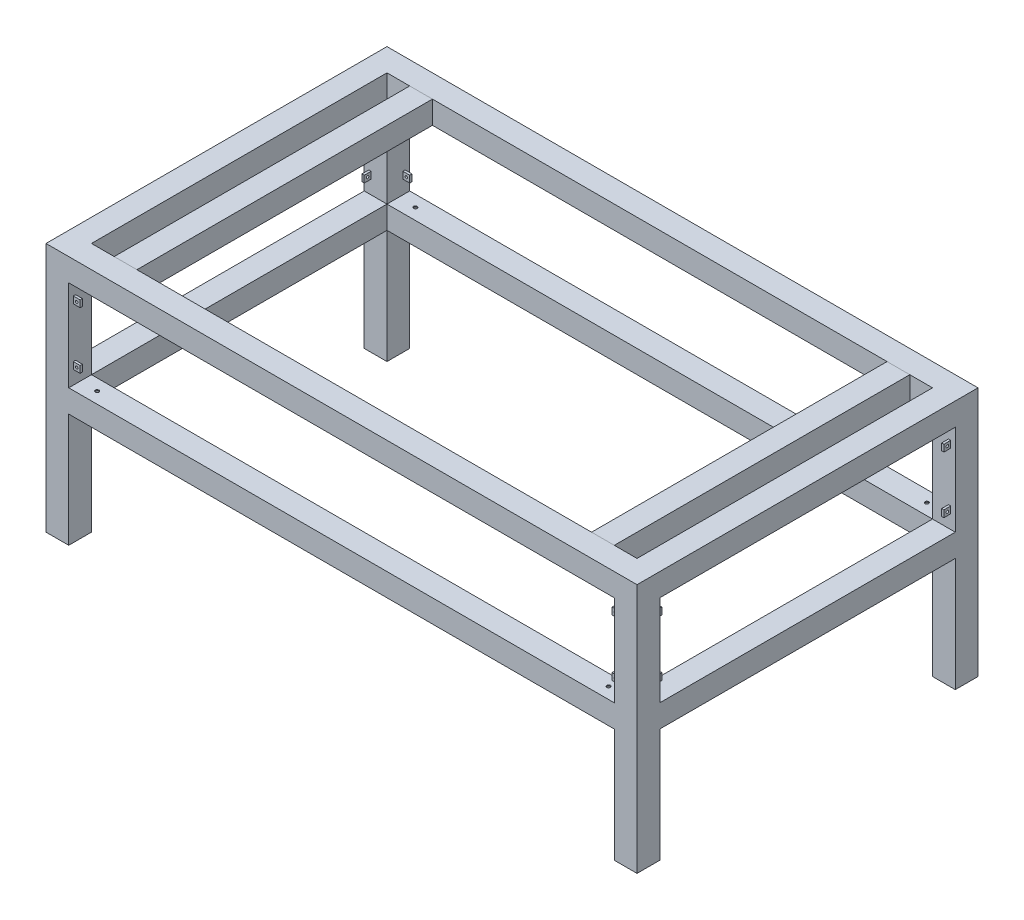
from build123d import *

# Parameters (mm, degrees)
ESQUISSE1_W             = 1300
ESQUISSE1_H             = 750
ESQUISSE1_W_2           = 1200
ESQUISSE1_H_2           = 650
BOSS_EXTRU_1_DEPTH      = 550
ESQUISSE2_W             = 1200
ESQUISSE2_H             = 200
ESQUISSE2_H_2           = 250
ENL_V_MAT_EXTRU_1_DEPTH = 1599.436736315
ESQUISSE3_W             = 650
ESQUISSE3_H             = 200
ESQUISSE3_H_2           = 250
ENL_V_MAT_EXTRU_2_DEPTH = 1599.436736315
ESQUISSE4_W             = 50
ESQUISSE4_H             = 650
BOSS_EXTRU_2_DEPTH      = 50
BOSS_EXTRU_2_2_DEPTH    = 50
ESQUISSE5_W             = 5
ESQUISSE5_H             = 15
BOSS_EXTRU_3_DEPTH      = 15
ESQUISSE6_W             = 5
ESQUISSE6_H             = 15
BOSS_EXTRU_4_DEPTH      = 15
ESQUISSE7_W             = 5
ESQUISSE7_H             = 15
BOSS_EXTRU_5_DEPTH      = 15
ESQUISSE8_W             = 5
ESQUISSE8_H             = 15
BOSS_EXTRU_6_DEPTH      = 15
ESQUISSE10_W            = 5
ESQUISSE10_H            = 15
BOSS_EXTRU_7_DEPTH      = 15
ESQUISSE12_W            = 5
ESQUISSE12_H            = 15
BOSS_EXTRU_8_DEPTH      = 15
ESQUISSE14_W            = 5
ESQUISSE14_H            = 15
BOSS_EXTRU_9_DEPTH      = 15
ESQUISSE15_W            = 5
ESQUISSE15_H            = 15
BOSS_EXTRU_10_DEPTH     = 15
ESQUISSE16_R            = 2.75
ENL_V_MAT_EXTRU_3_DEPTH = 1500
ESQUISSE17_R            = 2.75
ENL_V_MAT_EXTRU_4_DEPTH = 1000
ESQUISSE18_R            = 4
ENL_V_MAT_EXTRU_5_DEPTH = 80
ESQUISSE19_R            = 15
ENL_V_MAT_EXTRU_6_DEPTH = 48


with BuildPart() as part:
    # Esquisse1 → Boss.-Extru.1 (new body)
    with BuildSketch(Plane(origin=(0, 0, 0), x_dir=(1, 0, 0), z_dir=(0, 1, 0))):
        with Locations((650, 375)):
            Rectangle(ESQUISSE1_W, ESQUISSE1_H)
        with Locations((650, 375)):
            Rectangle(ESQUISSE1_W_2, ESQUISSE1_H_2, mode=Mode.SUBTRACT)
    extrude(amount=-BOSS_EXTRU_1_DEPTH)

    # Esquisse2 → Enlèv. mat.-Extru.1 (cut, through all)
    with BuildSketch(Plane.XY):
        with Locations((650, -150)):
            Rectangle(ESQUISSE2_W, ESQUISSE2_H)
        with Locations((650, -425)):
            Rectangle(ESQUISSE2_W, ESQUISSE2_H_2)
    extrude(amount=-ENL_V_MAT_EXTRU_1_DEPTH, mode=Mode.SUBTRACT)

    # Esquisse3 → Enlèv. mat.-Extru.2 (cut, through all)
    with BuildSketch(Plane.ZY):
        with Locations((-375, -150)):
            Rectangle(ESQUISSE3_W, ESQUISSE3_H)
        with Locations((-375, -425)):
            Rectangle(ESQUISSE3_W, ESQUISSE3_H_2)
    extrude(amount=-ENL_V_MAT_EXTRU_2_DEPTH, mode=Mode.SUBTRACT)

    # Esquisse5 → Boss.-Extru.3 (add)
    with BuildSketch(Plane.ZY.offset(-1250)):
        with Locations((-737.5, -87.5)):
            Rectangle(ESQUISSE5_W, ESQUISSE5_H)
        with Locations((-737.5, -212.5)):
            Rectangle(ESQUISSE5_W, ESQUISSE5_H)
    extrude(amount=BOSS_EXTRU_3_DEPTH)

    # Esquisse6 → Boss.-Extru.4 (add)
    with BuildSketch(Plane.XY.offset(-700)):
        with Locations((1287.5, -87.5)):
            Rectangle(ESQUISSE6_W, ESQUISSE6_H)
        with Locations((1287.5, -212.5)):
            Rectangle(ESQUISSE6_W, ESQUISSE6_H)
    extrude(amount=BOSS_EXTRU_4_DEPTH)

    # Esquisse7 → Boss.-Extru.5 (add)
    with BuildSketch(Plane(origin=(50, 0, 0), x_dir=(0, 0, -1), z_dir=(1, 0, 0))):
        with Locations((737.5, -87.5)):
            Rectangle(ESQUISSE7_W, ESQUISSE7_H)
        with Locations((737.5, -212.5)):
            Rectangle(ESQUISSE7_W, ESQUISSE7_H)
    extrude(amount=BOSS_EXTRU_5_DEPTH)

    # Esquisse8 → Boss.-Extru.6 (add)
    with BuildSketch(Plane.XY.offset(-700)):
        with Locations((12.5, -87.5)):
            Rectangle(ESQUISSE8_W, ESQUISSE8_H)
        with Locations((12.5, -212.5)):
            Rectangle(ESQUISSE8_W, ESQUISSE8_H)
    extrude(amount=BOSS_EXTRU_6_DEPTH)

    # Esquisse10 → Boss.-Extru.7 (add)
    with BuildSketch(Plane(origin=(50, 0, 0), x_dir=(0, 0, -1), z_dir=(1, 0, 0))):
        with Locations((12.5, -87.5)):
            Rectangle(ESQUISSE10_W, ESQUISSE10_H)
        with Locations((12.5, -212.5)):
            Rectangle(ESQUISSE10_W, ESQUISSE10_H)
    extrude(amount=BOSS_EXTRU_7_DEPTH)

    # Esquisse12 → Boss.-Extru.8 (add)
    with BuildSketch(Plane(origin=(0, 0, -50), x_dir=(-1, 0, 0), z_dir=(0, 0, -1))):
        with Locations((-12.5, -87.5)):
            Rectangle(ESQUISSE12_W, ESQUISSE12_H)
        with Locations((-12.5, -212.5)):
            Rectangle(ESQUISSE12_W, ESQUISSE12_H)
    extrude(amount=BOSS_EXTRU_8_DEPTH)

    # Esquisse14 → Boss.-Extru.9 (add)
    with BuildSketch(Plane.ZY.offset(-1250)):
        with Locations((-12.5, -87.5)):
            Rectangle(ESQUISSE14_W, ESQUISSE14_H)
        with Locations((-12.5, -212.5)):
            Rectangle(ESQUISSE14_W, ESQUISSE14_H)
    extrude(amount=BOSS_EXTRU_9_DEPTH)

    # Esquisse15 → Boss.-Extru.10 (add)
    with BuildSketch(Plane(origin=(0, 0, -50), x_dir=(-1, 0, 0), z_dir=(0, 0, -1))):
        with Locations((-1287.5, -87.5)):
            Rectangle(ESQUISSE15_W, ESQUISSE15_H)
        with Locations((-1287.5, -212.5)):
            Rectangle(ESQUISSE15_W, ESQUISSE15_H)
    extrude(amount=BOSS_EXTRU_10_DEPTH)

    # Esquisse16 → Enlèv. mat.-Extru.3 (cut)
    with BuildSketch(Plane(origin=(1290, 0, 0), x_dir=(0, 0, -1), z_dir=(1, 0, 0))):
        with Locations((57.5, -87.5)):
            Circle(ESQUISSE16_R)
        with Locations((57.5, -212.5)):
            Circle(ESQUISSE16_R)
        with Locations((692.5, -87.5)):
            Circle(ESQUISSE16_R)
        with Locations((692.5, -212.5)):
            Circle(ESQUISSE16_R)
    extrude(amount=-ENL_V_MAT_EXTRU_3_DEPTH, mode=Mode.SUBTRACT)

    # Esquisse17 → Enlèv. mat.-Extru.4 (cut)
    with BuildSketch(Plane.XY.offset(-10)):
        with Locations((57.5, -87.5)):
            Circle(ESQUISSE17_R)
        with Locations((57.5, -212.5)):
            Circle(ESQUISSE17_R)
        with Locations((1242.5, -212.5)):
            Circle(ESQUISSE17_R)
        with Locations((1242.5, -87.5)):
            Circle(ESQUISSE17_R)
    extrude(amount=-ENL_V_MAT_EXTRU_4_DEPTH, mode=Mode.SUBTRACT)

    # Esquisse18 → Enlèv. mat.-Extru.5 (cut)
    with BuildSketch(Plane(origin=(0, -250, 0), x_dir=(1, 0, 0), z_dir=(0, 1, 0))):
        with Locations((1212.5, 25)):
            Circle(ESQUISSE18_R)
        with Locations((87.5, 25)):
            Circle(ESQUISSE18_R)
        with Locations((87.5, 725)):
            Circle(ESQUISSE18_R)
        with Locations((1212.5, 725)):
            Circle(ESQUISSE18_R)
    extrude(amount=-ENL_V_MAT_EXTRU_5_DEPTH, mode=Mode.SUBTRACT)

    # Esquisse19 → Enlèv. mat.-Extru.6 (cut)
    with BuildSketch(Plane(origin=(0, -300, 0), x_dir=(-1, 0, 0), z_dir=(0, -1, 0))):
        with Locations((-1212.5, 725)):
            Circle(ESQUISSE19_R)
        with Locations((-87.5, 725)):
            Circle(ESQUISSE19_R)
        with Locations((-87.5, 25)):
            Circle(ESQUISSE19_R)
        with Locations((-1212.5, 25)):
            Circle(ESQUISSE19_R)
    extrude(amount=-ENL_V_MAT_EXTRU_6_DEPTH, mode=Mode.SUBTRACT)


with BuildPart() as body_2:
    # Esquisse4 → Boss.-Extru.2 (new body)
    with BuildSketch(Plane(origin=(0, 0, 0), x_dir=(1, 0, 0), z_dir=(0, 1, 0))):
        with Locations((125, 375)):
            Rectangle(ESQUISSE4_W, ESQUISSE4_H)
    extrude(amount=-BOSS_EXTRU_2_DEPTH)


with BuildPart() as body_3:
    # Esquisse4 → Boss.-Extru.2 2 (new body)
    with BuildSketch(Plane(origin=(0, 0, 0), x_dir=(1, 0, 0), z_dir=(0, 1, 0))):
        with Locations((1175, 375)):
            Rectangle(ESQUISSE4_W, ESQUISSE4_H)
    extrude(amount=-BOSS_EXTRU_2_2_DEPTH)


solid = Compound([part.part, body_2.part, body_3.part])
